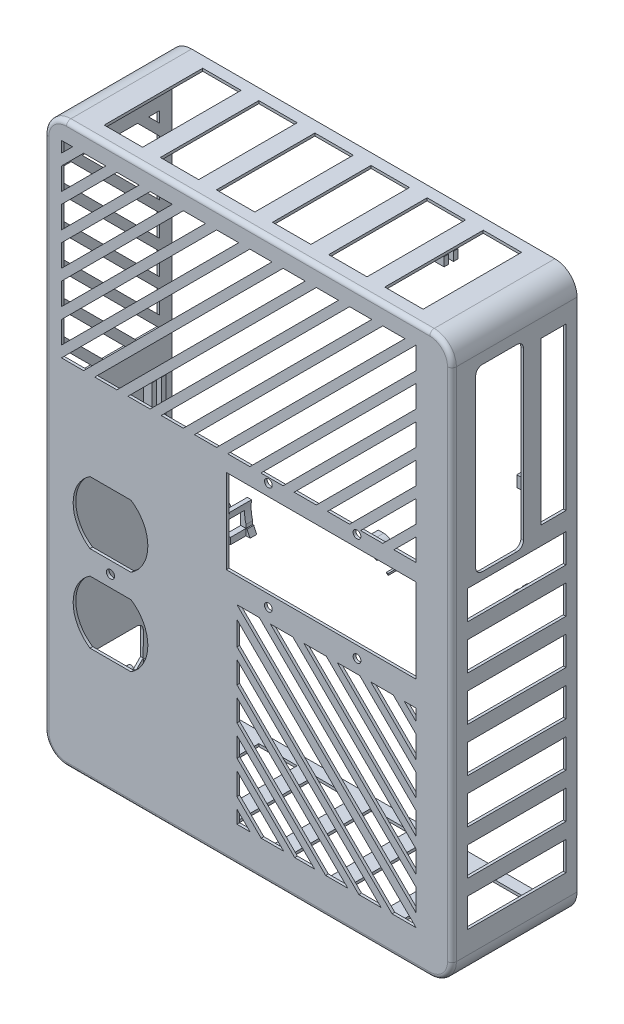
from build123d import *

# Parameters (mm, degrees)
BOSS_EXTRUDE1_DEPTH            = 5
BOSS_EXTRUDE1_DEPTH_BACK       = 51.45
SKETCH1_W                      = 183.924765437
SKETCH1_H                      = 252.487455025
FILLET1_R                      = 10
FILLET2_R                      = 2
SHELL1_T                       = -1.2
CUT_EXTRUDE2_DEPTH             = 57
CUT_EXTRUDE2_DEPTH_BACK        = 57
SKETCH1_4_OUTSIDE_W            = 249.411
SKETCH1_4_OUTSIDE_H            = 317.974
SKETCH1_4_OUTSIDE_W_2          = 183.924765437
SKETCH1_4_OUTSIDE_H_2          = 252.487455025
SKETCH1_4_OUTSIDE_R            = 1.838525958
CUT_EXTRUDE3_START             = -1.2
CUT_EXTRUDE3_DEPTH             = 1.2
SKETCH4_R                      = 1.5
SKETCH4_R_2                    = 1.55
CUT_EXTRUDE4_DEPTH             = 1.2
SKETCH5_R                      = 1.5
BOSS_EXTRUDE2_DEPTH            = 8
FILLET3_R                      = 2
SKETCH6_R                      = 3.5
SKETCH6_R_2                    = 1.5
EXTRUDE_THIN1_DEPTH            = 10
SKETCH7_W                      = 2
SKETCH7_H                      = 40
SKETCH7_H_2                    = 5
BOSS_EXTRUDE3_DEPTH            = 4
SKETCH8_W                      = 2
SKETCH8_H                      = 5
SKETCH8_W_2                    = 5
SKETCH8_H_2                    = 2
BOSS_EXTRUDE4_DEPTH            = 4
SKETCH9_W                      = 2
SKETCH9_H                      = 5
BOSS_EXTRUDE5_DEPTH            = 1.5
BOSS_EXTRUDE8_START            = -14.247561496
BOSS_EXTRUDE8_DEPTH            = 2
SKETCH11_R                     = 1.5
CUT_EXTRUDE5_DEPTH             = 2
SKETCH12_W                     = 2
SKETCH12_H                     = 5
BOSS_EXTRUDE9_DEPTH            = 3
SKETCH14_W                     = 5
SKETCH14_H                     = 2
BOSS_EXTRUDE10_DEPTH           = 4
SKETCH15_R                     = 1.5
BOSS_EXTRUDE11_DEPTH           = 8
SKETCH16_W                     = 9.67744747
SKETCH16_H                     = 12.360228073
SKETCH16_W_2                   = 5.026126851
SKETCH16_H_2                   = 6.704183289
BOSS_EXTRUDE12_DEPTH           = 10
CUT_EXTRUDE6_REACH             = 756.441
SKETCH18_W                     = 7
SKETCH18_H                     = 6.704183289
CUT_EXTRUDE6_DIRECTION_2_REACH = 756.441
SKETCH19_W                     = 5.026126851
SKETCH19_H                     = 7
CUT_EXTRUDE7_DEPTH             = 12.360228073
CUT_EXTRUDE17_START            = -11.2
SKETCH29_R                     = 19
SKETCH29_R_2                   = 1.75
CUT_EXTRUDE17_DEPTH            = 11.2
CUT_EXTRUDE8_DEPTH             = 1.2
CUT_EXTRUDE9_DEPTH             = 19.202438504
SKETCH22_W                     = 21.578596498
SKETCH22_H                     = 80.969578247
CUT_EXTRUDE10_DEPTH            = 1.2
FILLET4_R                      = 3
CUT_EXTRUDE11_DEPTH            = 1.2
SKETCH24_W                     = 17.32079424
SKETCH24_H                     = 44.45
SKETCH24_W_2                   = 17.320794239
CUT_EXTRUDE12_DEPTH            = 1.2
CUT_EXTRUDE13_START            = -251.287455
SKETCH24_2_W                   = 17.32079424
SKETCH24_2_H                   = 44.45
SKETCH24_2_W_2                 = 17.320794239
CUT_EXTRUDE13_DEPTH            = 1.2
SKETCH25_W                     = 44.45
SKETCH25_H                     = 13.048054735
CUT_EXTRUDE14_DEPTH            = 1.2
SKETCH26_W                     = 11.160090689
SKETCH26_H                     = 72.929332305
CUT_EXTRUDE15_DEPTH            = 1.2
SKETCH28_W                     = 85.637522732
SKETCH28_H                     = 38
CUT_EXTRUDE16_DEPTH            = 1.2


# Read off the part's stored shape, not the designer's step: Cut-Extrude3, Boss-Extrude8
with BuildPart() as part:
    # Sketch1 → Boss-Extrude1 (new, two sides: drawn at the far end of the back side and taken through both)
    with BuildSketch(Plane.XY.offset(14.202438504).offset(-BOSS_EXTRUDE1_DEPTH_BACK)):
        with Locations((-9.230867637, -620.459135549)):
            Rectangle(SKETCH1_W, SKETCH1_H)
    extrude(amount=BOSS_EXTRUDE1_DEPTH + BOSS_EXTRUDE1_DEPTH_BACK)

    # Fillet1
    fillet1_edges = [part.edges().sort_by_distance(p)[0] for p in [
        (-101.193250355, -746.702863061, -9.022561496),
        (82.731515082, -746.702863061, -9.022561496),
        (82.731515082, -494.215408036, -9.022561496),
        (-101.193250355, -494.215408036, -9.022561496),
    ]]
    fillet(fillet1_edges, radius=FILLET1_R)

    # Fillet2
    fillet2_edges = [part.edges().sort_by_distance(p)[0] for p in [
        (-101.193250355, -620.459135548, 19.202438504),
        (-9.230867636, -494.215408036, 19.202438504),
        (-9.230867636, -746.702863061, 19.202438504),
        (82.731515082, -620.459135548, 19.202438504),
        (-98.264318167, -743.773930873, 19.202438504),
        (79.802582894, -743.773930873, 19.202438504),
        (79.802582894, -497.144340224, 19.202438504),
        (-98.264318167, -497.144340224, 19.202438504),
    ]]
    fillet(fillet2_edges, radius=FILLET2_R)

    # Shell1
    shell1_openings = [part.faces().sort_by_distance(p)[0] for p in [
        (-9.230867636, -620.459135548, -37.247561496),
    ]]
    offset(amount=SHELL1_T, openings=shell1_openings, kind=Kind.INTERSECTION)

    # Sketch1<4> outside → Cut-Extrude2 (cut, two sides: drawn at the far end of the back side and taken through both)
    # profile 1 of 4: a face of its own
    with BuildSketch(Plane.XY.offset(14.202438504).offset(-CUT_EXTRUDE2_DEPTH_BACK)):
        with Locations((-9.2305, -620.459)):
            Rectangle(SKETCH1_4_OUTSIDE_W, SKETCH1_4_OUTSIDE_H)
        with Locations((-9.230867637, -620.459135549)):
            Rectangle(SKETCH1_4_OUTSIDE_W_2, SKETCH1_4_OUTSIDE_H_2, mode=Mode.SUBTRACT)
    # profile 2 of 4: a face of its own
    with BuildSketch(Plane.XY.offset(14.202438504).offset(-CUT_EXTRUDE2_DEPTH_BACK)):
        with Locations(Location((-71.349250355, -661.308863061, 0), (0, 0, 180))):
            Circle(SKETCH1_4_OUTSIDE_R)
    # profile 3 of 4: a face of its own
    with BuildSketch(Plane.XY.offset(14.202438504).offset(-CUT_EXTRUDE2_DEPTH_BACK)):
        with BuildLine():
            Line((-80.604126471, -694.836863061), (-62.094374239, -694.836863061))
            ThreePointArc((-62.094374239, -694.836863061), (-54.496350355, -680.752563061), (-62.094374239, -666.668263061))
            Line((-62.094374239, -666.668263061), (-80.604126471, -666.668263061))
            ThreePointArc((-80.604126471, -666.668263061), (-88.202150355, -680.752563061), (-80.604126471, -694.836863061))
        make_face()
    # profile 4 of 4: a face of its own
    with BuildSketch(Plane.XY.offset(14.202438504).offset(-CUT_EXTRUDE2_DEPTH_BACK)):
        with BuildLine():
            Line((-62.094374239, -627.780863061), (-80.604126471, -627.780863061))
            ThreePointArc((-80.604126471, -627.780863061), (-88.202150355, -641.865163061), (-80.604126471, -655.949463061))
            Line((-80.604126471, -655.949463061), (-62.094374239, -655.949463061))
            ThreePointArc((-62.094374239, -655.949463061), (-54.496350355, -641.865163061), (-62.094374239, -627.780863061))
        make_face()
    extrude(amount=CUT_EXTRUDE2_DEPTH + CUT_EXTRUDE2_DEPTH_BACK, mode=Mode.SUBTRACT)

    # Cut-Extrude3 outline → Cut-Extrude3 (cut)
    with BuildSketch(Plane.ZY.offset(101.193250355).offset(CUT_EXTRUDE3_START)):
        with BuildLine():
            Line((2.706766224, -730.083944983), (2.75243189, -719.209162771))
            ThreePointArc((2.75243189, -719.209162771), (1.875984963, -717.083771172), (-0.247561496, -716.202863061))
            Line((-0.247561496, -716.202863061), (-21.247561496, -716.202863061))
            ThreePointArc((-21.247561496, -716.202863061), (-23.373331729, -717.086001962), (-24.247535038, -719.215462452))
            Line((-24.247535038, -719.215462452), (-24.201889215, -730.083944983))
            Line((-24.201889215, -730.083944983), (-18.928643418, -735.357190781))
            Line((-18.928643418, -735.357190781), (-2.566479574, -735.357190781))
            Line((-2.566479574, -735.357190781), (2.706766224, -730.083944983))
        make_face()
    extrude(amount=CUT_EXTRUDE3_DEPTH, mode=Mode.SUBTRACT)

    # Sketch4 → Cut-Extrude4 (cut)
    with BuildSketch(Plane.ZY.offset(101.193250355)):
        with Locations((-30.847561496, -725.802863061)):
            Circle(SKETCH4_R)
        with Locations((9.352438504, -725.802863061)):
            Circle(SKETCH4_R_2)
    extrude(amount=-CUT_EXTRUDE4_DEPTH, mode=Mode.SUBTRACT)

    # Sketch5 → Boss-Extrude2 (add)
    with BuildSketch(Plane(origin=(0, 0, 18.002438504), x_dir=(-1, 0, 0), z_dir=(0, 0, -1))):
        with Locations((71.349250355, -702.838953497)):
            Circle(SKETCH5_R)
        with Locations((71.349250355, -619.62864326)):
            Circle(SKETCH5_R)
    extrude(amount=BOSS_EXTRUDE2_DEPTH)

    # Fillet3
    fillet3_edges = [part.edges().sort_by_distance(p)[0] for p in [
        (-69.849250355, -702.838953497, 18.002438504),
        (-69.849250355, -619.62864326, 18.002438504),
    ]]
    fillet(fillet3_edges, radius=FILLET3_R)

    # Sketch6 → Extrude-Thin1 (add)
    # profile 1 of 2: a face of its own
    with BuildSketch(Plane(origin=(0, 0, 18.002438504), x_dir=(-1, 0, 0), z_dir=(0, 0, -1))):
        with Locations((31.305250355, -710.514863061)):
            Circle(SKETCH6_R)
        with Locations((31.305250355, -710.514863061)):
            Circle(SKETCH6_R_2, mode=Mode.SUBTRACT)
    # profile 2 of 2: a face of its own
    with BuildSketch(Plane(origin=(0, 0, 18.002438504), x_dir=(-1, 0, 0), z_dir=(0, 0, -1))):
        with Locations((31.305250355, -620.514863061)):
            Circle(SKETCH6_R)
        with Locations((31.305250355, -620.514863061)):
            Circle(SKETCH6_R_2, mode=Mode.SUBTRACT)
    extrude(amount=EXTRUDE_THIN1_DEPTH)

    # Sketch7 → Boss-Extrude3 (add)
    with BuildSketch(Plane(origin=(-99.993250355, 0, 0), x_dir=(0, 0, -1), z_dir=(1, 0, 0))):
        with Locations((29.447561496, -640.514863061)):
            Rectangle(SKETCH7_W, SKETCH7_H)
        with Locations((29.447561496, -733.202863061)):
            Rectangle(SKETCH7_W, SKETCH7_H_2)
        with Locations((25.247561496, -733.202863061)):
            Rectangle(SKETCH7_W, SKETCH7_H_2)
        with Locations((25.247561496, -640.514863061)):
            Rectangle(SKETCH7_W, SKETCH7_H)
    extrude(amount=BOSS_EXTRUDE3_DEPTH)

    # Sketch8 → Boss-Extrude4 (add)
    with BuildSketch(Plane(origin=(0, 0, 18.002438504), x_dir=(-1, 0, 0), z_dir=(0, 0, -1))):
        with Locations((-51.731515082, -602.127239774)):
            Rectangle(SKETCH8_W, SKETCH8_H)
        with Locations((32.305250355, -723.702863061)):
            Rectangle(SKETCH8_W_2, SKETCH8_H_2)
    extrude(amount=BOSS_EXTRUDE4_DEPTH)

    # Sketch9 → Boss-Extrude5 (add)
    with BuildSketch(Plane.ZY.offset(-81.531515082)):
        with Locations((-16.447561496, -610.127239774)):
            Rectangle(SKETCH9_W, SKETCH9_H)
        with Locations((-12.247561496, -610.127239774)):
            Rectangle(SKETCH9_W, SKETCH9_H)
    extrude(amount=BOSS_EXTRUDE5_DEPTH)

    # Boss-Extrude8 outline → Boss-Extrude8 (add)
    with BuildSketch(Plane.XY.offset(BOSS_EXTRUDE8_START)):
        with BuildLine():
            Line((81.531515082, -736.702863061), (72.731515082, -736.702863061))
            Line((72.731515082, -736.702863061), (72.731515082, -745.502863061))
            ThreePointArc((72.731515082, -745.502863061), (78.954054757, -742.925402736), (81.531515082, -736.702863061))
        make_face()
    extrude(amount=BOSS_EXTRUDE8_DEPTH)

    # Sketch11 → Cut-Extrude5 (cut)
    with BuildSketch(Plane(origin=(0, 0, -14.247561496), x_dir=(-1, 0, 0), z_dir=(0, 0, -1))):
        with Locations(Location((-75.731515082, -739.702863061, 0), (0, 0, 90))):
            Circle(SKETCH11_R)
    extrude(amount=-CUT_EXTRUDE5_DEPTH, mode=Mode.SUBTRACT)

    # Sketch12 → Boss-Extrude9 (add)
    with BuildSketch(Plane.ZY.offset(-81.531515082)):
        with Locations((-19.447561496, -566.715408036)):
            Rectangle(SKETCH12_W, SKETCH12_H)
        with Locations((-15.247561496, -566.715408036)):
            Rectangle(SKETCH12_W, SKETCH12_H)
    extrude(amount=BOSS_EXTRUDE9_DEPTH)

    # Sketch14 → Boss-Extrude10 (add)
    with BuildSketch(Plane.XZ.offset(495.415408036)):
        with Locations((43.231515082, -19.447561496)):
            Rectangle(SKETCH14_W, SKETCH14_H)
        with Locations((43.231515082, -15.247561496)):
            Rectangle(SKETCH14_W, SKETCH14_H)
    extrude(amount=BOSS_EXTRUDE10_DEPTH)

    # Sketch15 → Boss-Extrude11 (add)
    with BuildSketch(Plane(origin=(0, 0, 18.002438504), x_dir=(-1, 0, 0), z_dir=(0, 0, -1))):
        with BuildLine():
            Line((-42.731515082, -592.831160904), (-40.292175254, -592.831160904))
            Line((-40.292175254, -592.831160904), (-40.292175254, -596.770500733))
            ThreePointArc((-40.292175254, -596.770500733), (-41.31730152, -599.245374467), (-43.792175254, -600.270500733))
            Line((-43.792175254, -600.270500733), (-47.731515082, -600.270500733))
            Line((-47.731515082, -600.270500733), (-47.731515082, -597.831160904))
            ThreePointArc((-47.731515082, -597.831160904), (-46.267048988, -594.295626999), (-42.731515082, -592.831160904))
        make_face()
        with Locations((-43.792175254, -596.770500733)):
            Circle(SKETCH15_R, mode=Mode.SUBTRACT)
    extrude(amount=BOSS_EXTRUDE11_DEPTH)

    # Sketch16 → Boss-Extrude12 (add)
    with BuildSketch(Plane(origin=(0, 0, 18.002438504), x_dir=(-1, 0, 0), z_dir=(0, 0, -1))):
        with Locations((15.944731385, -617.76623102)):
            Rectangle(SKETCH16_W, SKETCH16_H)
        with Locations((15.895358069, -617.713095125)):
            Rectangle(SKETCH16_W_2, SKETCH16_H_2, mode=Mode.SUBTRACT)
    extrude(amount=BOSS_EXTRUDE12_DEPTH)

    # Cut-Extrude6: up to this face of the body (flat: up to its plane)
    cut_extrude6_end = Plane(part.part.faces().sort_by_distance((-20.78345512, -617.76623102, 13.002438504))[0])
    # Sketch18 → Cut-Extrude6 (cut, up to the picked face)
    with BuildSketch(Plane(origin=(-18.408421494, 0, 0), x_dir=(0, 0, -1), z_dir=(1, 0, 0)), mode=Mode.PRIVATE) as cut_extrude6_sk1:
        with Locations((-14.502438504, -617.713095125)):
            Rectangle(SKETCH18_W, SKETCH18_H)
    cut_extrude6_tool1 = split(extrude(cut_extrude6_sk1.sketch, amount=-CUT_EXTRUDE6_REACH, mode=Mode.PRIVATE), bisect_by=cut_extrude6_end, keep=Keep.BOTH, mode=Mode.PRIVATE)
    add(cut_extrude6_tool1.solids().sort_by(Axis((-18.408421, -617.713095, 14.502439), (-1, 0, 0)))[0], mode=Mode.SUBTRACT)

    # Cut-Extrude6 direction 2: up to this face of the body (flat: up to its plane)
    cut_extrude6_direction_2_end = Plane(part.part.faces().sort_by_distance((-11.10600765, -617.76623102, 13.002438504))[0])
    # Sketch18 → Cut-Extrude6 direction 2 (cut, up to the picked face)
    with BuildSketch(Plane(origin=(-18.408421494, 0, 0), x_dir=(0, 0, -1), z_dir=(1, 0, 0)), mode=Mode.PRIVATE) as cut_extrude6_direction_2_sk1:
        with Locations((-14.502438504, -617.713095125)):
            Rectangle(SKETCH18_W, SKETCH18_H)
    cut_extrude6_direction_2_tool1 = split(extrude(cut_extrude6_direction_2_sk1.sketch, amount=CUT_EXTRUDE6_DIRECTION_2_REACH, mode=Mode.PRIVATE), bisect_by=cut_extrude6_direction_2_end, keep=Keep.BOTH, mode=Mode.PRIVATE)
    add(cut_extrude6_direction_2_tool1.solids().sort_by(Axis((-18.408421, -617.713095, 14.502439), (1, 0, 0)))[0], mode=Mode.SUBTRACT)

    # Sketch19 → Cut-Extrude7 (cut)
    with BuildSketch(Plane.XZ.offset(623.946345056)):
        with Locations((-15.895358069, 14.502438504)):
            Rectangle(SKETCH19_W, SKETCH19_H)
    extrude(amount=-CUT_EXTRUDE7_DEPTH, mode=Mode.SUBTRACT)

    # Sketch29 → Cut-Extrude17 (cut)
    with BuildSketch(Plane.XY.offset(19.202438504).offset(CUT_EXTRUDE17_START)):
        with Locations((-0.10600765, -614.402863061)):
            Circle(SKETCH29_R)
        with Locations((39.89399235, -614.402863061)):
            Circle(SKETCH29_R)
        with Locations((-0.10600765, -638.652863061)):
            Circle(SKETCH29_R_2)
        with Locations((39.89399235, -638.652863061)):
            Circle(SKETCH29_R_2)
        with Locations((-0.10600765, -590.152863061)):
            Circle(SKETCH29_R_2)
        with Locations((39.89399235, -590.152863061)):
            Circle(SKETCH29_R_2)
    extrude(amount=CUT_EXTRUDE17_DEPTH, mode=Mode.SUBTRACT)

    # Sketch20 → Cut-Extrude8 (cut)
    with BuildSketch(Plane(origin=(0, 0, 18.002438504), x_dir=(-1, 0, 0), z_dir=(0, 0, -1))):
        Polygon((-66.531515082, -587.831160904), (-66.531515082, -577.831160904), (-56.531515082, -587.831160904), align=None)
        Polygon((-66.531515082, -572.831160904), (-66.531515082, -562.831160904), (-41.531515082, -587.831160904), (-51.531515082, -587.831160904), align=None)
        Polygon((-66.531515082, -557.831160904), (-66.531515082, -547.831160904), (-26.531515082, -587.831160904), (-36.531515082, -587.831160904), align=None)
        Polygon((-11.531515082, -587.831160904), (-66.531515082, -532.831160904), (-66.531515082, -542.831160904), (-21.531515082, -587.831160904), align=None)
        Polygon((3.468484918, -587.831160904), (-6.531515082, -587.831160904), (-66.531515082, -527.831160904), (-66.531515082, -517.831160904), align=None)
        Polygon((18.468484918, -587.831160904), (8.468484918, -587.831160904), (-66.531515082, -512.831160904), (-66.531515082, -502.831160904), align=None)
        Polygon((23.468484918, -587.831160904), (33.468484918, -587.831160904), (-51.531515082, -502.831160904), (-61.531515082, -502.831160904), align=None)
        Polygon((-46.531515082, -502.831160904), (-36.531515082, -502.831160904), (48.468484918, -587.831160904), (38.468484918, -587.831160904), align=None)
        Polygon((-31.531515082, -502.831160904), (-21.531515082, -502.831160904), (63.468484918, -587.831160904), (53.468484918, -587.831160904), align=None)
        Polygon((-16.531515082, -502.831160904), (-6.531515082, -502.831160904), (78.468484918, -587.831160904), (68.468484918, -587.831160904), align=None)
        Polygon((-1.531515082, -502.831160904), (8.468484918, -502.831160904), (93.468484918, -587.831160904), (83.468484918, -587.831160904), align=None)
        Polygon((93.468484918, -582.831160904), (93.468484918, -572.831160904), (23.468484918, -502.831160904), (13.468484918, -502.831160904), align=None)
        Polygon((28.468484918, -502.831160904), (38.468484918, -502.831160904), (93.468484918, -557.831160904), (93.468484918, -567.831160904), align=None)
        Polygon((43.468484918, -502.831160904), (53.468484918, -502.831160904), (93.468484918, -542.831160904), (93.468484918, -552.831160904), align=None)
        Polygon((93.468484918, -527.831160904), (93.468484918, -537.831160904), (58.468484918, -502.831160904), (68.468484918, -502.831160904), align=None)
        Polygon((83.468484918, -502.831160904), (93.468484918, -512.831160904), (93.468484918, -522.831160904), (73.468484918, -502.831160904), align=None)
        Polygon((88.468484918, -502.831160904), (93.468484918, -502.831160904), (93.468484918, -507.831160904), align=None)
    extrude(amount=-CUT_EXTRUDE8_DEPTH, mode=Mode.SUBTRACT)

    # Sketch21 → Cut-Extrude9 (cut)
    with BuildSketch(Plane.XY):
        Polygon((61.231515082, -644.702863061), (66.531515082, -644.702863061), (66.531515082, -649.950387814), align=None)
        Polygon((56.231515082, -644.702863061), (66.531515082, -654.900882863), (66.531515082, -664.900882863), (46.131515082, -644.702863061), align=None)
        Polygon((66.531515082, -669.851377913), (66.531515082, -679.851377913), (31.031515082, -644.702863061), (41.131515082, -644.702863061), align=None)
        Polygon((15.931515082, -644.702863061), (26.031515082, -644.702863061), (66.531515082, -684.801872962), (66.531515082, -694.801872962), align=None)
        Polygon((0.831515082, -644.702863061), (10.931515082, -644.702863061), (66.531515082, -699.752368012), (66.531515082, -709.752368012), align=None)
        Polygon((66.531515082, -724.702863061), (66.531515082, -714.702863061), (-4.168484918, -644.702863061), (-14.268484918, -644.702863061), align=None)
        Polygon((66.531515082, -730.502863061), (-14.268484918, -650.502863061), (-14.268484918, -661.195932368), (55.731515082, -730.502863061), align=None)
        Polygon((50.731515082, -730.502863061), (40.731515082, -730.502863061), (-14.268484918, -676.047417517), (-14.268484918, -666.146427418), align=None)
        Polygon((35.731515082, -730.502863061), (25.731515082, -730.502863061), (-14.268484918, -690.898902665), (-14.268484918, -680.997912566), align=None)
        Polygon((20.731515082, -730.502863061), (11.789515082, -730.502863061), (-14.268484918, -704.702863061), (-14.268484918, -695.849397715), align=None)
        Polygon((-3.360484918, -730.502863061), (6.789515082, -730.502863061), (-14.268484918, -709.653358111), (-14.268484918, -719.702863061), align=None)
        Polygon((-14.268484918, -724.653358111), (-14.268484918, -730.502863061), (-8.360484918, -730.502863061), align=None)
    extrude(amount=CUT_EXTRUDE9_DEPTH, mode=Mode.SUBTRACT)

    # Sketch22 → Cut-Extrude10 (cut)
    with BuildSketch(Plane.ZY.offset(-81.531515082)):
        with Locations((-2.298172558, -549.659951218)):
            Rectangle(SKETCH22_W, SKETCH22_H)
    extrude(amount=-CUT_EXTRUDE10_DEPTH, mode=Mode.SUBTRACT)

    # Fillet4
    fillet4_edges = [part.edges().sort_by_distance(p)[0] for p in [
        (82.131515082, -509.175162094, 8.491125691),
        (82.131515082, -590.144740341, 8.491125691),
        (82.131515082, -590.144740341, -13.087470807),
        (82.131515082, -509.175162094, -13.087470807),
    ]]
    fillet(fillet4_edges, radius=FILLET4_R)

    # Sketch23 → Cut-Extrude11 (cut)
    with BuildSketch(Plane(origin=(-101.193250355, 0, 118.395688859), x_dir=(0, 0, -1), z_dir=(1, 0, 0))):
        Polygon((106.703987692, -519.858258457), (106.703987692, -526.516340359), (150.045905791, -569.858258457), (150.045905791, -559.858258457), (110.045905791, -519.858258457), align=None)
        Polygon((150.045905791, -544.858258457), (125.045905791, -519.858258457), (115.045905791, -519.858258457), (150.045905791, -554.858258457), align=None)
        Polygon((140.045905791, -519.858258457), (130.045905791, -519.858258457), (150.045905791, -539.858258457), (150.045905791, -529.858258457), align=None)
        Polygon((145.045905791, -519.858258457), (150.045905791, -524.858258457), (150.045905791, -519.858258457), align=None)
        Polygon((150.045905791, -574.858258457), (106.703987692, -531.516340359), (106.703987692, -541.516340359), (150.045905791, -584.858258457), align=None)
        Polygon((106.703987692, -546.516340359), (106.703987692, -556.516340359), (150.045905791, -599.858258457), (150.045905791, -589.858258457), align=None)
        Polygon((106.703987692, -561.516340359), (106.703987692, -571.516340359), (140.045905791, -604.858258457), (150.045905791, -604.858258457), align=None)
        Polygon((106.703987692, -576.516340359), (106.703987692, -586.516340359), (125.045905791, -604.858258457), (135.045905791, -604.858258457), align=None)
        Polygon((106.703987692, -591.516340359), (106.703987692, -601.516340359), (110.045905791, -604.858258457), (120.045905791, -604.858258457), align=None)
    extrude(amount=CUT_EXTRUDE11_DEPTH, mode=Mode.SUBTRACT)

    # Sketch24 → Cut-Extrude12 (cut)
    with BuildSketch(Plane(origin=(0, -746.702863061, 0), x_dir=(-1, 0, 0), z_dir=(0, -1, 0))):
        with Locations((-28.750323723, 10.022561496)):
            Rectangle(SKETCH24_W, SKETCH24_H)
        with Locations((-54.071117962, 10.022561496)):
            Rectangle(SKETCH24_W_2, SKETCH24_H)
        with Locations((-3.429529484, 10.022561496)):
            Rectangle(SKETCH24_W_2, SKETCH24_H)
        with Locations((21.891264756, 10.022561496)):
            Rectangle(SKETCH24_W, SKETCH24_H)
        with Locations((47.212058996, 10.022561496)):
            Rectangle(SKETCH24_W_2, SKETCH24_H)
        with Locations((72.532853235, 10.022561496)):
            Rectangle(SKETCH24_W, SKETCH24_H)
    extrude(amount=-CUT_EXTRUDE12_DEPTH, mode=Mode.SUBTRACT)

    # Sketch24<2> → Cut-Extrude13 (cut)
    with BuildSketch(Plane(origin=(0, -746.702863061, 0), x_dir=(-1, 0, 0), z_dir=(0, -1, 0)).offset(CUT_EXTRUDE13_START)):
        with Locations((-28.750323723, 10.022561496)):
            Rectangle(SKETCH24_2_W, SKETCH24_2_H)
        with Locations((-54.071117962, 10.022561496)):
            Rectangle(SKETCH24_2_W_2, SKETCH24_2_H)
        with Locations((-3.429529484, 10.022561496)):
            Rectangle(SKETCH24_2_W_2, SKETCH24_2_H)
        with Locations((21.891264756, 10.022561496)):
            Rectangle(SKETCH24_2_W, SKETCH24_2_H)
        with Locations((47.212058996, 10.022561496)):
            Rectangle(SKETCH24_2_W_2, SKETCH24_2_H)
        with Locations((72.532853235, 10.022561496)):
            Rectangle(SKETCH24_2_W, SKETCH24_2_H)
    extrude(amount=-CUT_EXTRUDE13_DEPTH, mode=Mode.SUBTRACT)

    # Sketch25 → Cut-Extrude14 (cut)
    with BuildSketch(Plane.ZY.offset(-81.531515082)):
        with Locations((-10.022561496, -700.130780959)):
            Rectangle(SKETCH25_W, SKETCH25_H)
        with Locations((-10.022561496, -720.178835694)):
            Rectangle(SKETCH25_W, SKETCH25_H)
        with Locations((-10.022561496, -680.082726224)):
            Rectangle(SKETCH25_W, SKETCH25_H)
        with Locations((-10.022561496, -660.034671489)):
            Rectangle(SKETCH25_W, SKETCH25_H)
        with Locations((-10.022561496, -639.986616754)):
            Rectangle(SKETCH25_W, SKETCH25_H)
        with Locations((-10.022561496, -619.938562019)):
            Rectangle(SKETCH25_W, SKETCH25_H)
        with Locations((-10.022561496, -599.890507284)):
            Rectangle(SKETCH25_W, SKETCH25_H)
    extrude(amount=-CUT_EXTRUDE14_DEPTH, mode=Mode.SUBTRACT)

    # Sketch26 → Cut-Extrude15 (cut)
    with BuildSketch(Plane(origin=(82.731515082, 0, 0), x_dir=(0, 0, -1), z_dir=(1, 0, 0))):
        with Locations((26.667516152, -548.680074188)):
            Rectangle(SKETCH26_W, SKETCH26_H)
    extrude(amount=-CUT_EXTRUDE15_DEPTH, mode=Mode.SUBTRACT)

    # Sketch28 → Cut-Extrude16 (cut)
    with BuildSketch(Plane(origin=(0, 0, 18.002438504), x_dir=(-1, 0, 0), z_dir=(0, 0, -1))):
        with Locations((-23.712753716, -614.402863061)):
            Rectangle(SKETCH28_W, SKETCH28_H)
    extrude(amount=-CUT_EXTRUDE16_DEPTH, mode=Mode.SUBTRACT)


with BuildPart() as cut_extrude16_piece_1:
    # of the separate pieces the step leaves, piece 1, a body of its own (cut_extrude16_pieces)
    add(part.part.solids().sort_by_distance((81.531515082, -504.215408036, -37.247561496))[0])


with BuildPart() as cut_extrude16_piece_2:
    # of the separate pieces the step leaves, piece 2, a body of its own (cut_extrude16_pieces)
    add(part.part.solids().sort_by_distance((52.731515082, -600.395793057, 18.002438504))[0])


solid = Compound([cut_extrude16_piece_1.part, cut_extrude16_piece_2.part])
